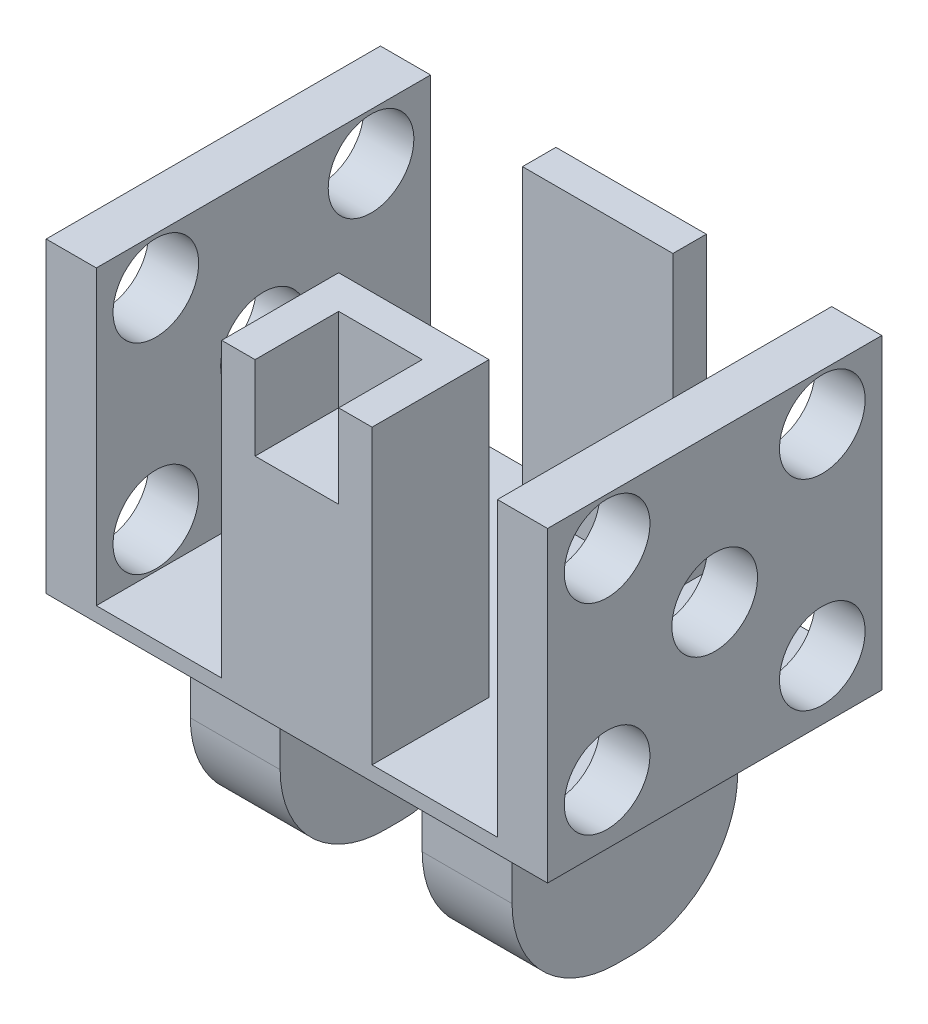
from build123d import *

# Parameters (mm, degrees)
BOSS_EXTRUDE1_DEPTH     = 54
CUT_EXTRUDE1_DEPTH      = 145.623649518
CUT_EXTRUDE1_DEPTH_BACK = 145.623649518
SKETCH2_R               = 10.25
CUT_EXTRUDE2_DEPTH      = 145.623649518
CUT_EXTRUDE2_DEPTH_BACK = 145.623649518
SKETCH3_R               = 10.25
CUT_EXTRUDE3_DEPTH      = 101.578327685
CUT_EXTRUDE3_DEPTH_BACK = 101.578327685
SKETCH4_W               = 21.5
SKETCH4_H               = 46.5
FILLET1_R               = 25
SKETCH5_W               = 120
SKETCH5_H               = 13
BOSS_EXTRUDE2_DEPTH     = 73.5
SKETCH6_W               = 30
SKETCH6_H               = 80
CUT_EXTRUDE4_DEPTH      = 70
SKETCH8_R               = 10.25
CUT_EXTRUDE6_DEPTH      = 20
SKETCH9_W               = 20
SKETCH9_H               = 20
CUT_EXTRUDE7_DEPTH      = 20
SKETCH10_W              = 36
SKETCH10_H              = 44
CUT_EXTRUDE8_DEPTH      = 70


with BuildPart() as part:
    # Sketch1 → Boss-Extrude1 (new body)
    with BuildSketch(Plane.XY):
        Polygon((60, 60), (-60, 60), (-60, -60), (-17, -60), (-17, -13.5), (17, -13.5), (17, -60), (60, -60), align=None)
    extrude(amount=BOSS_EXTRUDE1_DEPTH)

    # Sketch2 → Cut-Extrude1 (cut, two sides: drawn at the far end of the back side and taken through both)
    with BuildSketch(Plane(origin=(60, 0, 0), x_dir=(0, 0, -1), z_dir=(1, 0, 0)).offset(-CUT_EXTRUDE1_DEPTH_BACK)):
        with Locations((-27, -24.75)):
            Circle(SKETCH2_R)
    extrude(amount=CUT_EXTRUDE1_DEPTH + CUT_EXTRUDE1_DEPTH_BACK, mode=Mode.SUBTRACT)

    # Sketch3 → Cut-Extrude2 (cut, two sides: drawn at the far end of the back side and taken through both)
    with BuildSketch(Plane(origin=(60, 0, 0), x_dir=(0, 0, -1), z_dir=(1, 0, 0)).offset(-CUT_EXTRUDE2_DEPTH_BACK)):
        with Locations((-27, 24.75)):
            Circle(SKETCH3_R)
    extrude(amount=CUT_EXTRUDE2_DEPTH + CUT_EXTRUDE2_DEPTH_BACK, mode=Mode.SUBTRACT)

    # Sketch4 → Cut-Extrude3 (cut, two sides: drawn at the far end of the back side and taken through both)
    with BuildSketch(Plane.XY.offset(54).offset(-CUT_EXTRUDE3_DEPTH_BACK)):
        with Locations((-49.25, -36.75)):
            Rectangle(SKETCH4_W, SKETCH4_H)
        with Locations((49.25, -36.75)):
            Rectangle(SKETCH4_W, SKETCH4_H)
    extrude(amount=CUT_EXTRUDE3_DEPTH + CUT_EXTRUDE3_DEPTH_BACK, mode=Mode.SUBTRACT)

    # Fillet1
    fillet1_edges = [part.edges().sort_by_distance(p)[0] for p in [
        (-27.75, -60, 54),
        (-27.75, -60, 0),
        (27.75, -60, 0),
        (27.75, -60, 54),
    ]]
    fillet(fillet1_edges, radius=FILLET1_R)

    # Sketch5 → Boss-Extrude2 (add)
    with BuildSketch(Plane(origin=(0, 60, 0), x_dir=(1, 0, 0), z_dir=(0, 1, 0))):
        with Locations((0, 6.5)):
            Rectangle(SKETCH5_W, SKETCH5_H)
        with Locations((0, -60.5)):
            Rectangle(SKETCH5_W, SKETCH5_H)
    extrude(amount=-BOSS_EXTRUDE2_DEPTH)

    # Sketch6 → Cut-Extrude4 (cut)
    with BuildSketch(Plane(origin=(0, 60, 0), x_dir=(1, 0, 0), z_dir=(0, 1, 0))):
        with Locations((-33, -27)):
            Rectangle(SKETCH6_W, SKETCH6_H)
        with Locations((33, -27)):
            Rectangle(SKETCH6_W, SKETCH6_H)
    extrude(amount=-CUT_EXTRUDE4_DEPTH, mode=Mode.SUBTRACT)

    # Sketch8 → Cut-Extrude6 (cut)
    with BuildSketch(Plane(origin=(60, 0, 0), x_dir=(0, 0, -1), z_dir=(1, 0, 0))):
        with Locations((-52.75, 48.75)):
            Circle(SKETCH8_R)
        with Locations((-1.25, 48.75)):
            Circle(SKETCH8_R)
        with Locations((-1.25, 0.75)):
            Circle(SKETCH8_R)
        with Locations((-52.75, 0.75)):
            Circle(SKETCH8_R)
    cut_extrude6 = extrude(amount=-CUT_EXTRUDE6_DEPTH, mode=Mode.SUBTRACT)

    # Sketch9 → Cut-Extrude7 (cut)
    with BuildSketch(Plane.XY.offset(67)):
        with Locations((0, 50)):
            Rectangle(SKETCH9_W, SKETCH9_H)
    extrude(amount=-CUT_EXTRUDE7_DEPTH, mode=Mode.SUBTRACT)

    # Mirror1: Cut-Extrude6 across plane
    add(cut_extrude6.mirror(Plane(origin=(0, 0, 0), x_dir=(0, 0, 1), z_dir=(1, 0, 0))), mode=Mode.SUBTRACT)

    # Sketch10 → Cut-Extrude8 (cut)
    with BuildSketch(Plane(origin=(0, 60, 0), x_dir=(1, 0, 0), z_dir=(0, 1, 0))):
        with Locations((0, -17)):
            Rectangle(SKETCH10_W, SKETCH10_H)
    extrude(amount=-CUT_EXTRUDE8_DEPTH, mode=Mode.SUBTRACT)


solid = part.part
